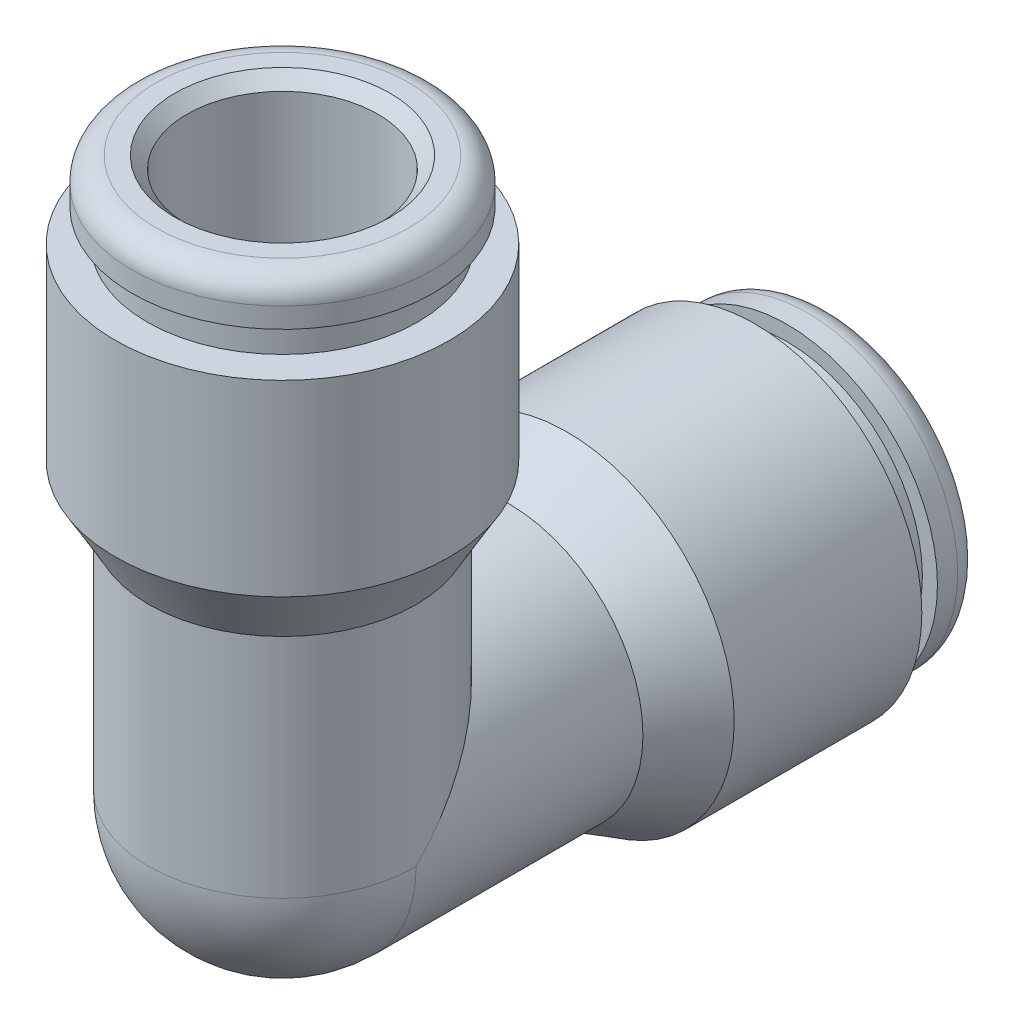
from build123d import *

# Parameters (mm, degrees)
CIRPATTERN1_COUNT = 2
CIRPATTERN1_ANGLE = 90
REVOLVE2_ANGLE    = 90
CIRPATTERN2_COUNT = 2
CIRPATTERN2_ANGLE = 90


with BuildPart() as part:
    # Sketch1 → Revolve1 (revolve)
    with BuildSketch(Plane(origin=(0, 0, 0), x_dir=(0, 0, -1), z_dir=(1, 0, 0))):
        with BuildLine():
            Line((15.853, 4.725), (16.488, 4.725))
            ThreePointArc((16.488, 4.725), (17.026815367, 4.501815367), (17.25, 3.963))
            Line((17.25, 3.963), (17.25, 3.381))
            Line((17.25, 3.381), (16.869, 3))
            Line((16.869, 3), (6, 3))
            Line((6, 3), (6, 2.238))
            Line((6, 2.238), (0, 2.238))
            Line((0, 2.238), (0, 4.2))
            Line((0, 4.2), (7.125, 4.2))
            Line((7.125, 4.2), (8.943653348, 5.25))
            Line((8.943653348, 5.25), (14.837, 5.25))
            Line((14.837, 5.25), (14.837, 4.2525))
            Line((14.837, 4.2525), (15.853, 4.2525))
            Line((15.853, 4.2525), (15.853, 4.725))
        make_face()
    revolve(axis=Axis((0, 0, 0), (0, 0, -1)))


with BuildPart() as cirpattern1_1:
    # CirPattern1: pattern copy
    add(part.part.rotate(Axis((-5.775, 0, 0), (1, 0, 0)), 1 * CIRPATTERN1_ANGLE / (CIRPATTERN1_COUNT - 1)))


with BuildPart() as part_1:
    add(part.part)

    # Sketch2 → Revolve2 (revolve)
    with BuildSketch(Plane.XY):
        with BuildLine():
            Line((-4.2, 0), (-2.238, 0))
            ThreePointArc((-2.238, 0), (0, -2.238), (2.238, 0))
            Line((2.238, 0), (4.2, 0))
            ThreePointArc((4.2, 0), (0, -4.2), (-4.2, 0))
        make_face()
    revolve(axis=Axis((-4.2, 0, 0), (-1, 0, 0)), revolution_arc=REVOLVE2_ANGLE)

    # Combine1: union CirPattern1_1
    add(cirpattern1_1.part)

    # Sketch3 → Cut-Revolve1 (revolve, cut)
    with BuildSketch(Plane(origin=(0, 0, 0), x_dir=(0, 0, -1), z_dir=(1, 0, 0))):
        Polygon((17.25, 3.381), (16.869, 3), (6, 3), (6, 2.238), (0, 2.238), (0, 0), (17.25, 0), align=None)
    cut_revolve1 = revolve(axis=Axis((0, 0, 0), (0, 0, -1)), mode=Mode.SUBTRACT)

    # CirPattern2: Cut-Revolve1 ×2 about axis
    cirpattern2_axis = Axis((-5.775, 0, 0), (1, 0, 0))
    for i in range(1, CIRPATTERN2_COUNT):
        add(cut_revolve1.rotate(cirpattern2_axis, i * CIRPATTERN2_ANGLE / (CIRPATTERN2_COUNT - 1)), mode=Mode.SUBTRACT)


solid = part_1.part
